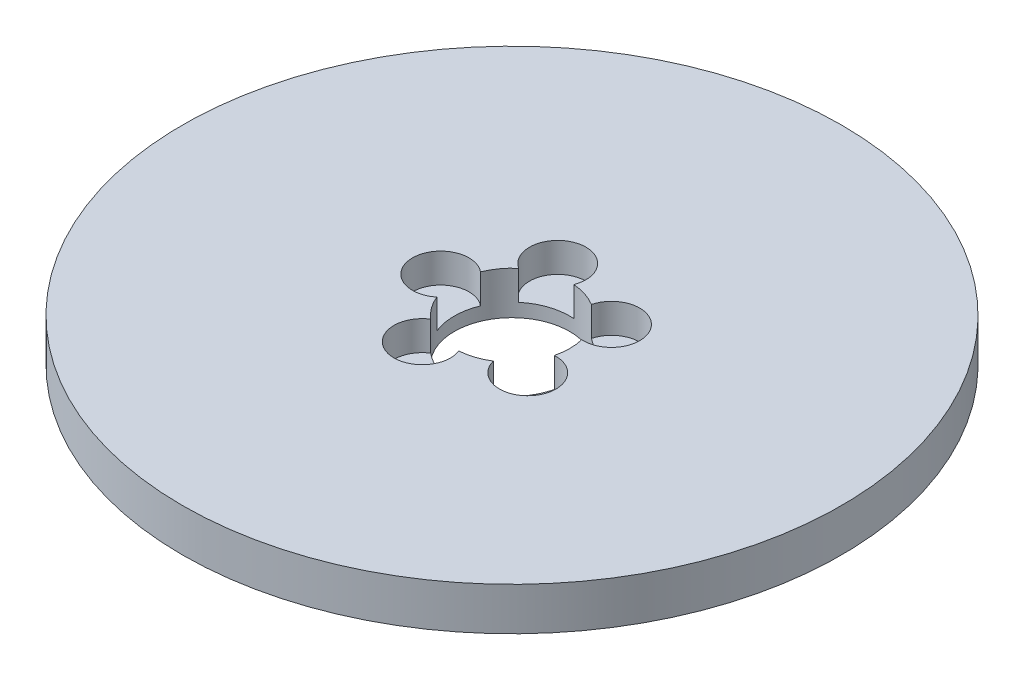
from build123d import *

# Parameters (mm, degrees)
SKETCH1_R           = 100
BOSS_EXTRUDE1_DEPTH = 13
SKETCH2_R           = 17.5
CUT_EXTRUDE1_DEPTH  = 143.017604543
SKETCH3_R           = 8.570149108
CUT_EXTRUDE2_DEPTH  = 8.937336264
CIRPATTERN1_COUNT   = 5


with BuildPart() as part:
    # Sketch1 → Boss-Extrude1 (new body)
    with BuildSketch(Plane(origin=(0, 0, 0), x_dir=(1, 0, 0), z_dir=(0, 1, 0))):
        Circle(SKETCH1_R)
    extrude(amount=BOSS_EXTRUDE1_DEPTH)

    # Sketch2 → Cut-Extrude1 (cut, through all)
    with BuildSketch(Plane(origin=(0, 0, 0), x_dir=(1, 0, 0), z_dir=(0, 1, 0))):
        Circle(SKETCH2_R)
    extrude(amount=CUT_EXTRUDE1_DEPTH, mode=Mode.SUBTRACT)

    # Sketch3 → Cut-Extrude2 (cut)
    with BuildSketch(Plane(origin=(0, 13, 0), x_dir=(1, 0, 0), z_dir=(0, 1, 0))):
        with Locations((-21.61816162, 0)):
            Circle(SKETCH3_R)
    cut_extrude2 = extrude(amount=-CUT_EXTRUDE2_DEPTH, mode=Mode.SUBTRACT)

    # CirPattern1: Cut-Extrude2 ×5 about axis
    cirpattern1_axis = Axis((0, 0, 0), (0, 1, 0))
    for i in range(1, CIRPATTERN1_COUNT):
        add(cut_extrude2.rotate(cirpattern1_axis, i * 360 / CIRPATTERN1_COUNT), mode=Mode.SUBTRACT)


solid = part.part
